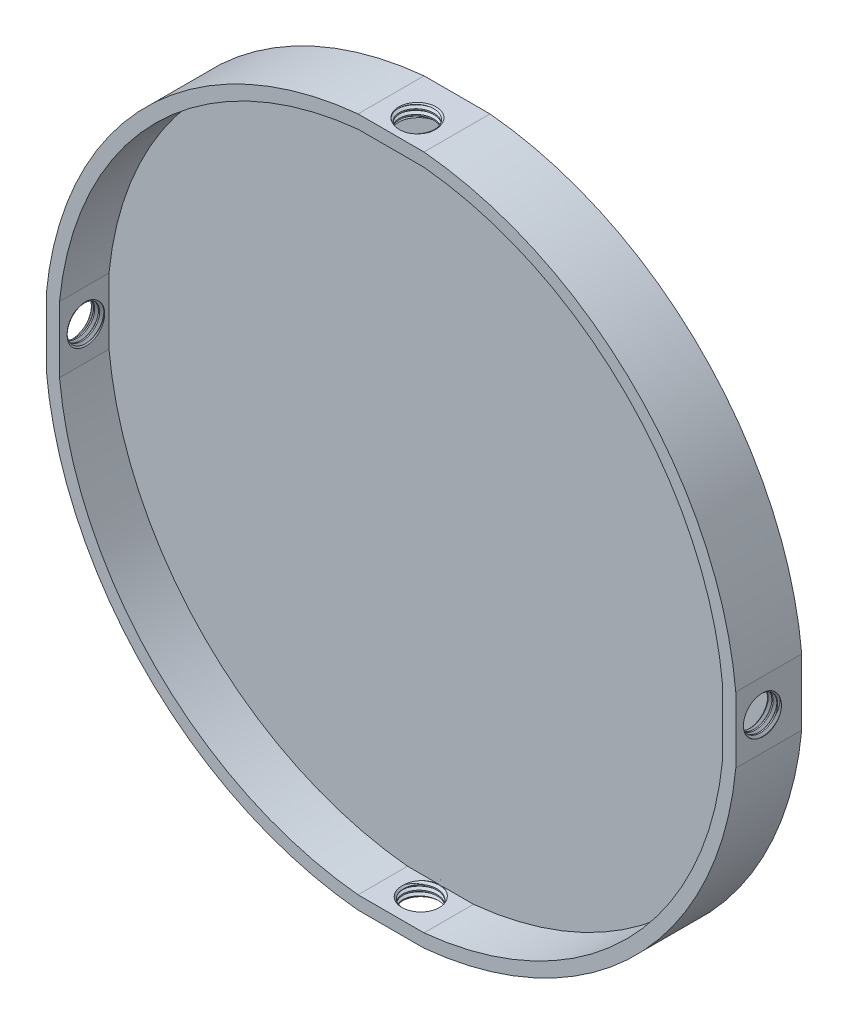
from build123d import *

# Parameters (mm, degrees)
BOSS_EXTRUDE1_DEPTH      = 15
BOSS_EXTRUDE1_DEPTH_BACK = 5
SKETCH2_R                = 105
SKETCH4_OUTSIDE_W        = 271.532
SKETCH4_OUTSIDE_H        = 271.532
CUT_EXTRUDE2_DEPTH       = 150.833240638
CUT_EXTRUDE3_DEPTH       = 15
SKETCH6_R                = 5.19
CUT_EXTRUDE5_DEPTH       = 15
CHAMFER1_SIZE            = 0.5
CHAMFER2_SIZE            = 0.5
THREAD1_PITCH            = 1.5
SKETCH7_R                = 5.19
CUT_EXTRUDE6_DEPTH       = 10
CHAMFER3_SIZE            = 0.5
THREAD2_PITCH            = 1.5
SKETCH10_R               = 5.19
CUT_EXTRUDE7_DEPTH       = 10
CHAMFER4_SIZE            = 0.5
THREAD3_PITCH            = 1.5
CUT_EXTRUDE8_START       = -10
SKETCH13_R               = 5.19
CUT_EXTRUDE8_DEPTH       = 10
CHAMFER5_SIZE            = 0.5
THREAD4_PITCH            = 1.5


with BuildPart() as part:
    # Sketch2 → Boss-Extrude1 (new, two sides: drawn at the far end of the back side and taken through both)
    with BuildSketch(Plane.XY.offset(-BOSS_EXTRUDE1_DEPTH_BACK)):
        Circle(SKETCH2_R)
    extrude(amount=BOSS_EXTRUDE1_DEPTH + BOSS_EXTRUDE1_DEPTH_BACK)

    # Sketch4 outside → Cut-Extrude2 (cut, through all)
    with BuildSketch(Plane.XY.offset(15)):
        Rectangle(SKETCH4_OUTSIDE_W, SKETCH4_OUTSIDE_H)
        with BuildLine():
            Line((-10, 104.522724802), (10, 104.522724802))
            ThreePointArc((10, 104.522724802), (74.246212025, 74.246212025), (104.522724802, 10))
            Line((104.522724802, 10), (104.522724802, -10))
            ThreePointArc((104.522724802, -10), (74.246212025, -74.246212025), (10, -104.522724802))
            Line((10, -104.522724802), (-10, -104.522724802))
            ThreePointArc((-10, -104.522724802), (-74.246212025, -74.246212025), (-104.522724802, -10))
            Line((-104.522724802, -10), (-104.522724802, 10))
            ThreePointArc((-104.522724802, 10), (-74.246212025, 74.246212025), (-10, 104.522724802))
        make_face(mode=Mode.SUBTRACT)
    extrude(amount=-CUT_EXTRUDE2_DEPTH, mode=Mode.SUBTRACT)

    # Sketch5 → Cut-Extrude3 (cut)
    with BuildSketch(Plane.XY.offset(15)):
        with BuildLine():
            Line((-10, 100.503731274), (10, 100.503731274))
            ThreePointArc((10, 100.503731274), (71.4177849, 71.4177849), (100.503731274, 10))
            Line((100.503731274, 10), (100.503731274, -10))
            ThreePointArc((100.503731274, -10), (71.4177849, -71.4177849), (10, -100.503731274))
            Line((10, -100.503731274), (-10, -100.503731274))
            ThreePointArc((-10, -100.503731274), (-71.4177849, -71.4177849), (-100.503731274, -10))
            Line((-100.503731274, -10), (-100.503731274, 10))
            ThreePointArc((-100.503731274, 10), (-71.4177849, 71.4177849), (-10, 100.503731274))
        make_face()
    extrude(amount=-CUT_EXTRUDE3_DEPTH, mode=Mode.SUBTRACT)

    # Sketch6 → Cut-Extrude5 (cut)
    with BuildSketch(Plane(origin=(0, -104.522724802, 0), x_dir=(-1, 0, 0), z_dir=(0, -1, 0))):
        with Locations(Location((0, -6, 0), (0, 0, 90))):
            Circle(SKETCH6_R)
    extrude(amount=-CUT_EXTRUDE5_DEPTH, mode=Mode.SUBTRACT)

    # Chamfer1
    chamfer1_edges = [part.edges().sort_by_distance(p)[0] for p in [
        (0, -104.522724802, 11.19),
    ]]
    chamfer(chamfer1_edges, length=CHAMFER1_SIZE)

    # Chamfer2
    chamfer2_edges = [part.edges().sort_by_distance(p)[0] for p in [
        (0, -100.503731274, 11.19),
    ]]
    chamfer(chamfer2_edges, length=CHAMFER2_SIZE)

    # Thread1: the profile of Thread Profile3 profile screwed along a right-hand helix of 4.345996 turns, 8 arcs to a turn; built about Z, then put on its axis
    thread1_z = Axis((0, 0, 0), (0, 0, 1))
    thread1_corners = [(5.1894, 0, -0.00034641), (6.001898813, 0, 0.468749998), (6.001898813, 0, 0.656249998), (5.1894, 0, 1.125346406)]
    with BuildLine(mode=Mode.PRIVATE) as thread1_profile:
        Line(thread1_corners[0], thread1_corners[1])
        Line(thread1_corners[1], thread1_corners[2])
        Line(thread1_corners[2], thread1_corners[3])
        Line(thread1_corners[3], thread1_corners[0])
    thread1_cap = Face(thread1_profile.wire())
    thread1_turn_angles = [0, 22.5, 45, 67.5, 90, 112.5, 135, 157.5, 180, 202.5, 225, 247.5, 270, 292.5, 315, 337.5, 360]
    thread1_turn_weights = [1, 0.9238795325112867, 1, 0.9238795325112867, 1, 0.9238795325112867, 1, 0.9238795325112867, 1, 0.9238795325112867, 1, 0.9238795325112867, 1, 0.9238795325112867, 1, 0.9238795325112867, 1]
    thread1_turn_rails = [Edge.make_bspline([Vector(p[0], p[1], 0).rotate(thread1_z, thread1_turn_angles[k]) / thread1_turn_weights[k] + Vector(0, 0, p[2] + THREAD1_PITCH * thread1_turn_angles[k] / 360) for k in range(17)], [0, 0, 0, 1, 1, 2, 2, 3, 3, 4, 4, 5, 5, 6, 6, 7, 7, 8, 8, 8], 2, thread1_turn_weights) for p in thread1_corners]
    thread1_turn_sides = [Face.make_surface_from_curves(thread1_turn_rails[p[0]], thread1_turn_rails[p[1]]) for p in [(0, 1), (1, 2), (2, 3), (3, 0)]]
    thread1_last_angles = [1440, 1462.5, 1485, 1507.5, 1530, 1547.279223338, 1564.558446676]
    thread1_last_weights = [1, 0.9238795325112867, 1, 0.9238795325112867, 1, 0.9548685711494762, 1]
    thread1_last_rails = [Edge.make_bspline([Vector(p[0], p[1], 0).rotate(thread1_z, thread1_last_angles[k]) / thread1_last_weights[k] + Vector(0, 0, p[2] + THREAD1_PITCH * thread1_last_angles[k] / 360) for k in range(7)], [0, 0, 0, 1, 1, 2, 2, 3, 3, 3], 2, thread1_last_weights) for p in thread1_corners]
    thread1_last_sides = [Face.make_surface_from_curves(thread1_last_rails[p[0]], thread1_last_rails[p[1]]) for p in [(0, 1), (1, 2), (2, 3), (3, 0)]]
    thread1 = Plane(origin=(0, -106.022724802, 6), x_dir=(1, 0, 0), z_dir=(0, 1, 0)) * Solid(Shell([*[p.moved(Location((0, 0, THREAD1_PITCH * i))) for i in range(4) for p in thread1_turn_sides], *thread1_last_sides, thread1_cap, thread1_cap.rotate(thread1_z, 1564.558446676).moved(Location((0, 0, THREAD1_PITCH * 1564.558446676 / 360)))]))
    add(thread1, mode=Mode.SUBTRACT)

    # Sketch7 → Cut-Extrude6 (cut)
    with BuildSketch(Plane(origin=(0, 104.522724802, 0), x_dir=(1, 0, 0), z_dir=(0, 1, 0))):
        with Locations(Location((0, -7, 0), (0, 0, 270))):
            Circle(SKETCH7_R)
    extrude(amount=-CUT_EXTRUDE6_DEPTH, mode=Mode.SUBTRACT)

    # Chamfer3
    chamfer3_edges = [part.edges().sort_by_distance(p)[0] for p in [
        (0, 100.503731274, 1.81),
        (0, 104.522724802, 1.81),
    ]]
    chamfer(chamfer3_edges, length=CHAMFER3_SIZE)

    # Thread2: the profile of Thread Profile4 profile screwed along a right-hand helix of 3.679329 turns, 8 arcs to a turn; built about Z, then put on its axis
    thread2_z = Axis((0, 0, 0), (0, 0, 1))
    thread2_corners = [(5.1897, 0, -0.000173205), (6.001898813, 0, 0.468749998), (6.001898813, 0, 0.656249998), (5.1897, 0, 1.125173201)]
    with BuildLine(mode=Mode.PRIVATE) as thread2_profile:
        Line(thread2_corners[0], thread2_corners[1])
        Line(thread2_corners[1], thread2_corners[2])
        Line(thread2_corners[2], thread2_corners[3])
        Line(thread2_corners[3], thread2_corners[0])
    thread2_cap = Face(thread2_profile.wire())
    thread2_turn_angles = [0, 22.5, 45, 67.5, 90, 112.5, 135, 157.5, 180, 202.5, 225, 247.5, 270, 292.5, 315, 337.5, 360]
    thread2_turn_weights = [1, 0.9238795325112867, 1, 0.9238795325112867, 1, 0.9238795325112867, 1, 0.9238795325112867, 1, 0.9238795325112867, 1, 0.9238795325112867, 1, 0.9238795325112867, 1, 0.9238795325112867, 1]
    thread2_turn_rails = [Edge.make_bspline([Vector(p[0], p[1], 0).rotate(thread2_z, thread2_turn_angles[k]) / thread2_turn_weights[k] + Vector(0, 0, p[2] + THREAD2_PITCH * thread2_turn_angles[k] / 360) for k in range(17)], [0, 0, 0, 1, 1, 2, 2, 3, 3, 4, 4, 5, 5, 6, 6, 7, 7, 8, 8, 8], 2, thread2_turn_weights) for p in thread2_corners]
    thread2_turn_sides = [Face.make_surface_from_curves(thread2_turn_rails[p[0]], thread2_turn_rails[p[1]]) for p in [(0, 1), (1, 2), (2, 3), (3, 0)]]
    thread2_last_angles = [1080, 1102.5, 1125, 1147.5, 1170, 1192.5, 1215, 1237.5, 1260, 1282.5, 1305, 1314.779223338, 1324.558446676]
    thread2_last_weights = [1, 0.9238795325112867, 1, 0.9238795325112867, 1, 0.9238795325112867, 1, 0.9238795325112867, 1, 0.9238795325112867, 1, 0.985469555260499, 1]
    thread2_last_rails = [Edge.make_bspline([Vector(p[0], p[1], 0).rotate(thread2_z, thread2_last_angles[k]) / thread2_last_weights[k] + Vector(0, 0, p[2] + THREAD2_PITCH * thread2_last_angles[k] / 360) for k in range(13)], [0, 0, 0, 1, 1, 2, 2, 3, 3, 4, 4, 5, 5, 6, 6, 6], 2, thread2_last_weights) for p in thread2_corners]
    thread2_last_sides = [Face.make_surface_from_curves(thread2_last_rails[p[0]], thread2_last_rails[p[1]]) for p in [(0, 1), (1, 2), (2, 3), (3, 0)]]
    thread2 = Plane(origin=(0, 106.022724802, 7), x_dir=(-1, 0, 0), z_dir=(0, -1, 0)) * Solid(Shell([*[p.moved(Location((0, 0, THREAD2_PITCH * i))) for i in range(3) for p in thread2_turn_sides], *thread2_last_sides, thread2_cap, thread2_cap.rotate(thread2_z, 1324.558446676).moved(Location((0, 0, THREAD2_PITCH * 1324.558446676 / 360)))]))
    add(thread2, mode=Mode.SUBTRACT)

    # Sketch10 → Cut-Extrude7 (cut)
    with BuildSketch(Plane.ZY.offset(104.522724802)):
        with Locations((7, 0)):
            Circle(SKETCH10_R)
    extrude(amount=-CUT_EXTRUDE7_DEPTH, mode=Mode.SUBTRACT)

    # Chamfer4
    chamfer4_edges = [part.edges().sort_by_distance(p)[0] for p in [
        (-100.503731274, 0, 1.81),
        (-104.522724802, 0, 1.81),
    ]]
    chamfer(chamfer4_edges, length=CHAMFER4_SIZE)

    # Thread3: the profile of Thread Profile5 profile screwed along a right-hand helix of 3.679329 turns, 8 arcs to a turn; built about Z, then put on its axis
    thread3_z = Axis((0, 0, 0), (0, 0, 1))
    thread3_corners = [(5.1897, 0, -0.000173205), (6.001898812, 0, 0.468749998), (6.001898812, 0, 0.656249998), (5.1897, 0, 1.125173201)]
    with BuildLine(mode=Mode.PRIVATE) as thread3_profile:
        Line(thread3_corners[0], thread3_corners[1])
        Line(thread3_corners[1], thread3_corners[2])
        Line(thread3_corners[2], thread3_corners[3])
        Line(thread3_corners[3], thread3_corners[0])
    thread3_cap = Face(thread3_profile.wire())
    thread3_turn_angles = [0, 22.5, 45, 67.5, 90, 112.5, 135, 157.5, 180, 202.5, 225, 247.5, 270, 292.5, 315, 337.5, 360]
    thread3_turn_weights = [1, 0.9238795325112867, 1, 0.9238795325112867, 1, 0.9238795325112867, 1, 0.9238795325112867, 1, 0.9238795325112867, 1, 0.9238795325112867, 1, 0.9238795325112867, 1, 0.9238795325112867, 1]
    thread3_turn_rails = [Edge.make_bspline([Vector(p[0], p[1], 0).rotate(thread3_z, thread3_turn_angles[k]) / thread3_turn_weights[k] + Vector(0, 0, p[2] + THREAD3_PITCH * thread3_turn_angles[k] / 360) for k in range(17)], [0, 0, 0, 1, 1, 2, 2, 3, 3, 4, 4, 5, 5, 6, 6, 7, 7, 8, 8, 8], 2, thread3_turn_weights) for p in thread3_corners]
    thread3_turn_sides = [Face.make_surface_from_curves(thread3_turn_rails[p[0]], thread3_turn_rails[p[1]]) for p in [(0, 1), (1, 2), (2, 3), (3, 0)]]
    thread3_last_angles = [1080, 1102.5, 1125, 1147.5, 1170, 1192.5, 1215, 1237.5, 1260, 1282.5, 1305, 1314.779223338, 1324.558446676]
    thread3_last_weights = [1, 0.9238795325112867, 1, 0.9238795325112867, 1, 0.9238795325112867, 1, 0.9238795325112867, 1, 0.9238795325112867, 1, 0.985469555260499, 1]
    thread3_last_rails = [Edge.make_bspline([Vector(p[0], p[1], 0).rotate(thread3_z, thread3_last_angles[k]) / thread3_last_weights[k] + Vector(0, 0, p[2] + THREAD3_PITCH * thread3_last_angles[k] / 360) for k in range(13)], [0, 0, 0, 1, 1, 2, 2, 3, 3, 4, 4, 5, 5, 6, 6, 6], 2, thread3_last_weights) for p in thread3_corners]
    thread3_last_sides = [Face.make_surface_from_curves(thread3_last_rails[p[0]], thread3_last_rails[p[1]]) for p in [(0, 1), (1, 2), (2, 3), (3, 0)]]
    thread3 = Plane(origin=(-106.022724802, 0, 7), x_dir=(0, 0, -1), z_dir=(1, 0, 0)) * Solid(Shell([*[p.moved(Location((0, 0, THREAD3_PITCH * i))) for i in range(3) for p in thread3_turn_sides], *thread3_last_sides, thread3_cap, thread3_cap.rotate(thread3_z, 1324.558446676).moved(Location((0, 0, THREAD3_PITCH * 1324.558446676 / 360)))]))
    add(thread3, mode=Mode.SUBTRACT)

    # Sketch13 → Cut-Extrude8 (cut)
    with BuildSketch(Plane(origin=(104.522724802, 0, 0), x_dir=(0, 0, -1), z_dir=(1, 0, 0)).offset(CUT_EXTRUDE8_START)):
        with Locations((-7, 0)):
            Circle(SKETCH13_R)
    extrude(amount=CUT_EXTRUDE8_DEPTH, mode=Mode.SUBTRACT)

    # Chamfer5
    chamfer5_edges = [part.edges().sort_by_distance(p)[0] for p in [
        (100.503731274, 0, 12.19),
        (104.522724802, 0, 12.19),
    ]]
    chamfer(chamfer5_edges, length=CHAMFER5_SIZE)

    # Thread4: the profile of Thread Profile6 profile screwed along a right-hand helix of 3.679329 turns, 8 arcs to a turn; built about Z, then put on its axis
    thread4_z = Axis((0, 0, 0), (0, 0, 1))
    thread4_corners = [(5.1897, 0, -0.000173205), (6.001898813, 0, 0.468749998), (6.001898813, 0, 0.656249998), (5.1897, 0, 1.125173201)]
    with BuildLine(mode=Mode.PRIVATE) as thread4_profile:
        Line(thread4_corners[0], thread4_corners[1])
        Line(thread4_corners[1], thread4_corners[2])
        Line(thread4_corners[2], thread4_corners[3])
        Line(thread4_corners[3], thread4_corners[0])
    thread4_cap = Face(thread4_profile.wire())
    thread4_turn_angles = [0, 22.5, 45, 67.5, 90, 112.5, 135, 157.5, 180, 202.5, 225, 247.5, 270, 292.5, 315, 337.5, 360]
    thread4_turn_weights = [1, 0.9238795325112867, 1, 0.9238795325112867, 1, 0.9238795325112867, 1, 0.9238795325112867, 1, 0.9238795325112867, 1, 0.9238795325112867, 1, 0.9238795325112867, 1, 0.9238795325112867, 1]
    thread4_turn_rails = [Edge.make_bspline([Vector(p[0], p[1], 0).rotate(thread4_z, thread4_turn_angles[k]) / thread4_turn_weights[k] + Vector(0, 0, p[2] + THREAD4_PITCH * thread4_turn_angles[k] / 360) for k in range(17)], [0, 0, 0, 1, 1, 2, 2, 3, 3, 4, 4, 5, 5, 6, 6, 7, 7, 8, 8, 8], 2, thread4_turn_weights) for p in thread4_corners]
    thread4_turn_sides = [Face.make_surface_from_curves(thread4_turn_rails[p[0]], thread4_turn_rails[p[1]]) for p in [(0, 1), (1, 2), (2, 3), (3, 0)]]
    thread4_last_angles = [1080, 1102.5, 1125, 1147.5, 1170, 1192.5, 1215, 1237.5, 1260, 1282.5, 1305, 1314.779223338, 1324.558446676]
    thread4_last_weights = [1, 0.9238795325112867, 1, 0.9238795325112867, 1, 0.9238795325112867, 1, 0.9238795325112867, 1, 0.9238795325112867, 1, 0.985469555260499, 1]
    thread4_last_rails = [Edge.make_bspline([Vector(p[0], p[1], 0).rotate(thread4_z, thread4_last_angles[k]) / thread4_last_weights[k] + Vector(0, 0, p[2] + THREAD4_PITCH * thread4_last_angles[k] / 360) for k in range(13)], [0, 0, 0, 1, 1, 2, 2, 3, 3, 4, 4, 5, 5, 6, 6, 6], 2, thread4_last_weights) for p in thread4_corners]
    thread4_last_sides = [Face.make_surface_from_curves(thread4_last_rails[p[0]], thread4_last_rails[p[1]]) for p in [(0, 1), (1, 2), (2, 3), (3, 0)]]
    thread4 = Plane(origin=(106.022724802, 0, 7), x_dir=(0, 0, 1), z_dir=(-1, 0, 0)) * Solid(Shell([*[p.moved(Location((0, 0, THREAD4_PITCH * i))) for i in range(3) for p in thread4_turn_sides], *thread4_last_sides, thread4_cap, thread4_cap.rotate(thread4_z, 1324.558446676).moved(Location((0, 0, THREAD4_PITCH * 1324.558446676 / 360)))]))
    add(thread4, mode=Mode.SUBTRACT)


solid = part.part
